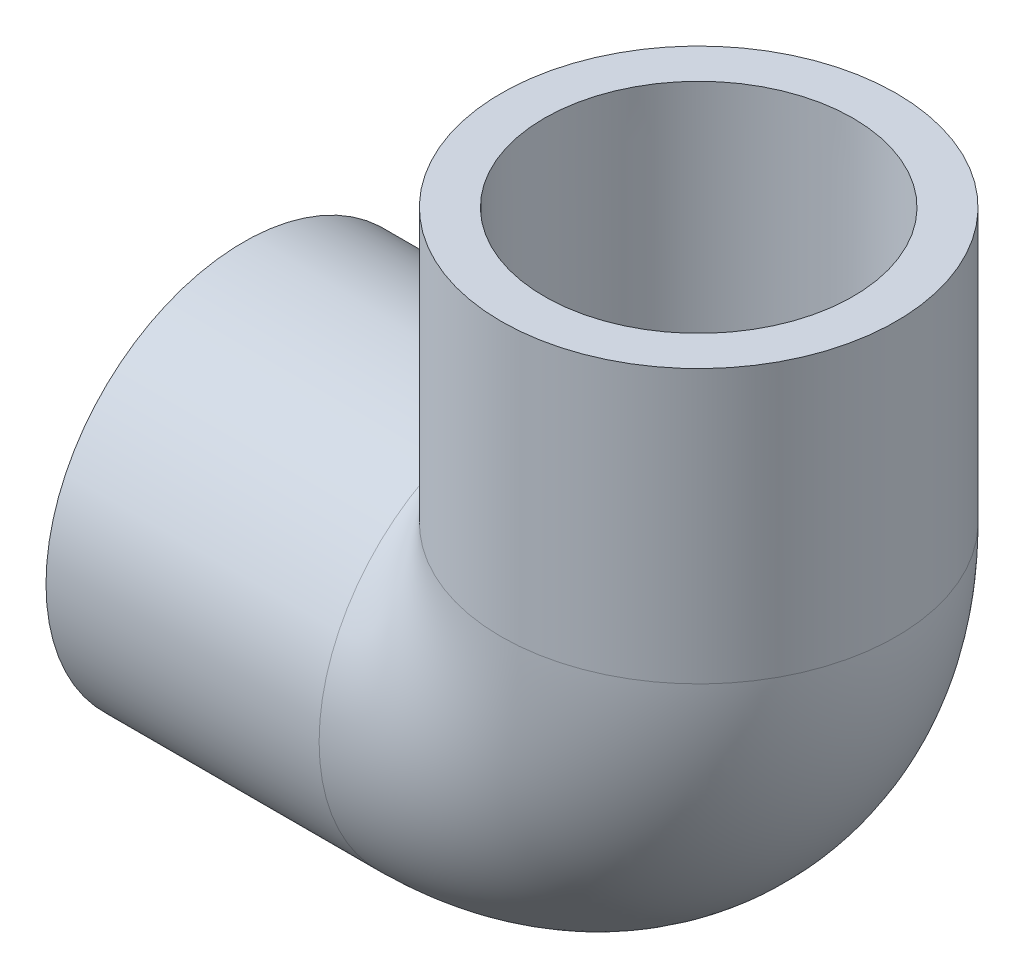
from build123d import *

# Parameters (mm, degrees)
SKETCH3_R   = 13.7795
SKETCH3_R_2 = 7.8994


with BuildPart() as part:
    # Sketch1 → Revolve1 (revolve)
    with BuildSketch(Plane.XY):
        Polygon((-31.75, -13.7795), (-12.7, -13.7795), (-12.7, -10.6172), (-31.75, -10.7696), align=None)
    revolve(axis=Axis((-31.75, 0, 0), (1, 0, 0)))


with BuildPart() as body_2:
    # Sketch2 → Revolve2 (revolve)
    with BuildSketch(Plane.XY):
        Polygon((10.7696, 31.75), (10.6172, 12.7), (13.7795, 12.7), (13.7795, 31.75), align=None)
    revolve(axis=Axis((0, 0, 0), (0, 1, 0)))


with BuildPart() as sweep1_tool:
    # Sweep1: sweep along a path in Sketch4
    with BuildLine(Plane.XY) as sweep1_path:
        ThreePointArc((-12.7, 0), (-3.719744, 3.719744), (0, 12.7))
    # Sketch3 → Sweep1 (sweep)
    with BuildSketch(Plane(origin=(-12.7, 0, 0), x_dir=(0, 0, -1), z_dir=(1, 0, 0))):
        Circle(SKETCH3_R)
        Circle(SKETCH3_R_2, mode=Mode.SUBTRACT)
    sweep(path=sweep1_path.line)


with BuildPart() as part_1:
    add(part.part)


with BuildPart() as part_2:
    # Sweep1: joined with sweep1_tool
    add(part_1.part.fuse(sweep1_tool.part, body_2.part, tol=0.00001))


solid = part_2.part
